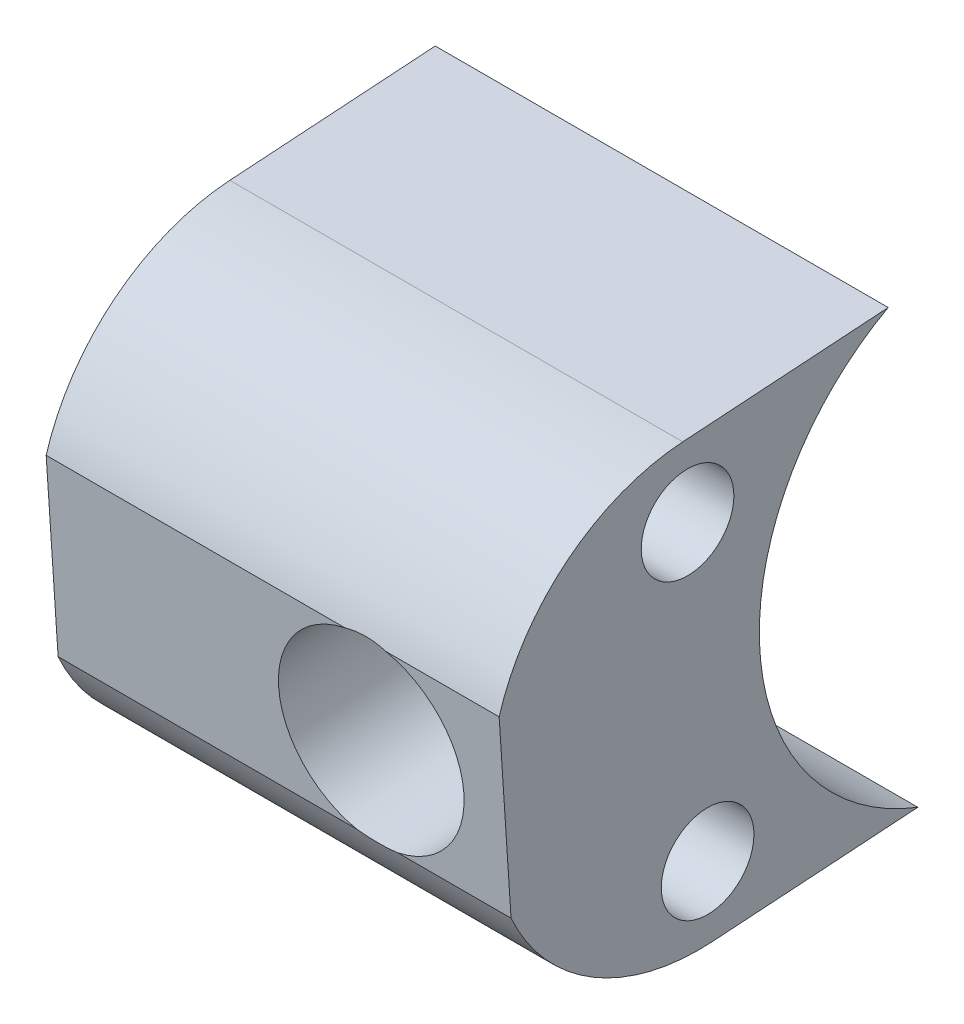
from build123d import *

# Parameters (mm, degrees)
BOSS_EXTRUDE1_DEPTH     = 25
CUT_EXTRUDE1_DEPTH      = 68.339268416
CUT_EXTRUDE1_DEPTH_BACK = 68.339268416
SKETCH2_R               = 4.5
SKETCH4_R               = 1
CUT_EXTRUDE3_DEPTH      = 114.552433231
SKETCH5_R               = 2.25
CUT_EXTRUDE4_DEPTH      = 13
SKETCH6_R               = 19.326103493
CUT_EXTRUDE5_DEPTH      = 3


with BuildPart() as part:
    # Sketch1 → Boss-Extrude1 (new body)
    with BuildSketch(Plane(origin=(-10, 0, 0), x_dir=(0, 0, -1), z_dir=(1, 0, 0))):
        with BuildLine():
            Line((-94.241028924, 40.727330875), (-94.820470526, 49.487368399))
            ThreePointArc((-94.820470526, 49.487368399), (-91.473573785, 54.437879066), (-85.901099289, 56.595841451))
            Line((-85.901099289, 56.595841451), (-75.922904242, 57.255859321))
            ThreePointArc((-75.922904242, 57.255859321), (-82.156438236, 45.925861069), (-74.484874616, 35.515629656))
            Line((-74.484874616, 35.515629656), (-84.463069663, 34.855611786))
            ThreePointArc((-84.463069663, 34.855611786), (-90.271231746, 36.260790377), (-94.241028924, 40.727330875))
        make_face()
    extrude(amount=BOSS_EXTRUDE1_DEPTH)

    # Sketch2 → Cut-Extrude1 (cut, two sides: drawn at the far end of the back side and taken through both)
    with BuildSketch(Plane(origin=(0, -6.245197791, 91.133983191), x_dir=(1, 0, 0), z_dir=(0, -0.06600178707669913, 0.9978195047716205)).offset(-CUT_EXTRUDE1_DEPTH_BACK)):
        with Locations((5.5, 51.464766105)):
            Circle(SKETCH2_R)
    extrude(amount=CUT_EXTRUDE1_DEPTH + CUT_EXTRUDE1_DEPTH_BACK, mode=Mode.SUBTRACT)

    # Sketch4 → Cut-Extrude3 (cut, through all)
    with BuildSketch(Plane.ZY.offset(10)):
        with Locations((85.669468509, 53.094031558)):
            Circle(SKETCH4_R)
        with Locations((84.694700444, 38.357421678)):
            Circle(SKETCH4_R)
    extrude(amount=-CUT_EXTRUDE3_DEPTH, mode=Mode.SUBTRACT)

    # Sketch5 → Cut-Extrude4 (cut)
    with BuildSketch(Plane(origin=(15, 0, 0), x_dir=(0, 0, -1), z_dir=(1, 0, 0))):
        with Locations((-84.694700444, 38.357421678)):
            Circle(SKETCH5_R)
        with Locations((-85.669468509, 53.094031558)):
            Circle(SKETCH5_R)
    extrude(amount=-CUT_EXTRUDE4_DEPTH, mode=Mode.SUBTRACT)

    # Sketch6 → Cut-Extrude5 (cut)
    with BuildSketch(Plane(origin=(15, 0, 0), x_dir=(0, 0, -1), z_dir=(1, 0, 0))):
        with Locations((-87.84559755, 44.780461754)):
            Circle(SKETCH6_R)
    extrude(amount=-CUT_EXTRUDE5_DEPTH, mode=Mode.SUBTRACT)


solid = part.part
